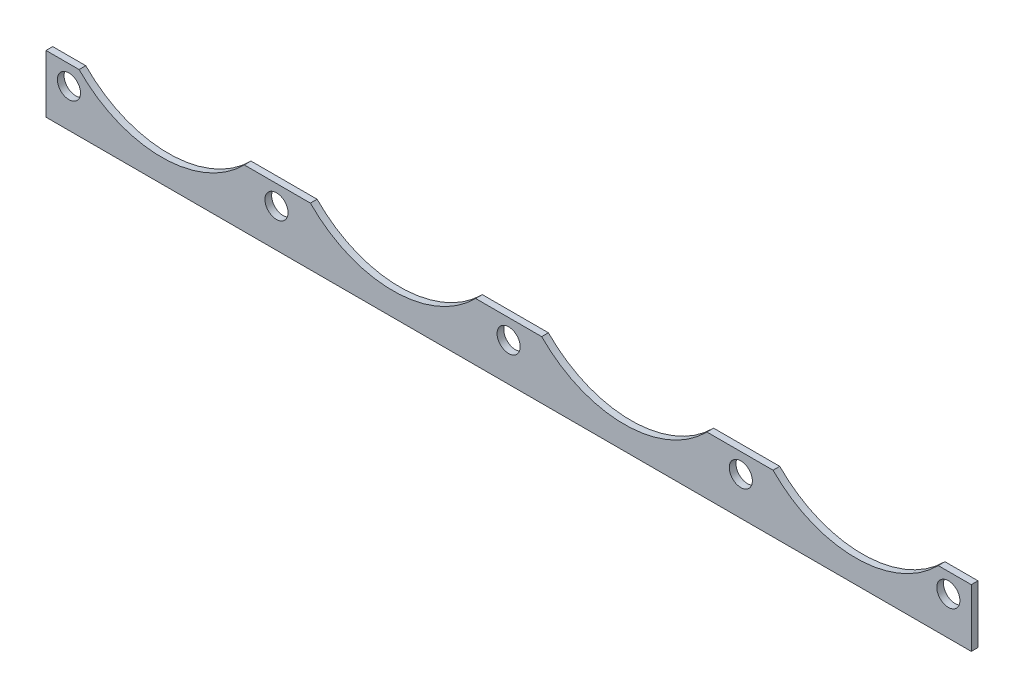
from build123d import *

# Parameters (mm, degrees)
SKETCH1_R           = 2.54
BOSS_EXTRUDE1_DEPTH = 0.7366


with BuildPart() as part:
    # Sketch1 → Boss-Extrude1 (new, symmetric)
    with BuildSketch(Plane.XY):
        with BuildLine():
            Line((7.260771792, 12.7), (-7.260771792, 12.7))
            ThreePointArc((-7.260771792, 12.7), (-25.4, 5.08), (-43.539228208, 12.7))
            Line((-43.539228208, 12.7), (-58.060771792, 12.7))
            ThreePointArc((-58.060771792, 12.7), (-76.2, 5.08), (-94.339228208, 12.7))
            Line((-94.339228208, 12.7), (-101.6, 12.7))
            Line((-101.6, 12.7), (-101.6, 0))
            Line((-101.6, 0), (101.6, 0))
            Line((101.6, 0), (101.6, 12.7))
            Line((101.6, 12.7), (94.339228208, 12.7))
            ThreePointArc((94.339228208, 12.7), (76.2, 5.08), (58.060771792, 12.7))
            Line((58.060771792, 12.7), (43.539228208, 12.7))
            ThreePointArc((43.539228208, 12.7), (25.4, 5.08), (7.260771792, 12.7))
        make_face()
        with Locations((0, 8.398896076)):
            Circle(SKETCH1_R, mode=Mode.SUBTRACT)
        with Locations((50.984733006, 8.398896076)):
            Circle(SKETCH1_R, mode=Mode.SUBTRACT)
        with Locations((96.562042846, 8.398896076)):
            Circle(SKETCH1_R, mode=Mode.SUBTRACT)
        with Locations((-96.562042846, 8.398896076)):
            Circle(SKETCH1_R, mode=Mode.SUBTRACT)
        with Locations((-50.984733006, 8.398896076)):
            Circle(SKETCH1_R, mode=Mode.SUBTRACT)
    extrude(amount=BOSS_EXTRUDE1_DEPTH, both=True)


solid = part.part
